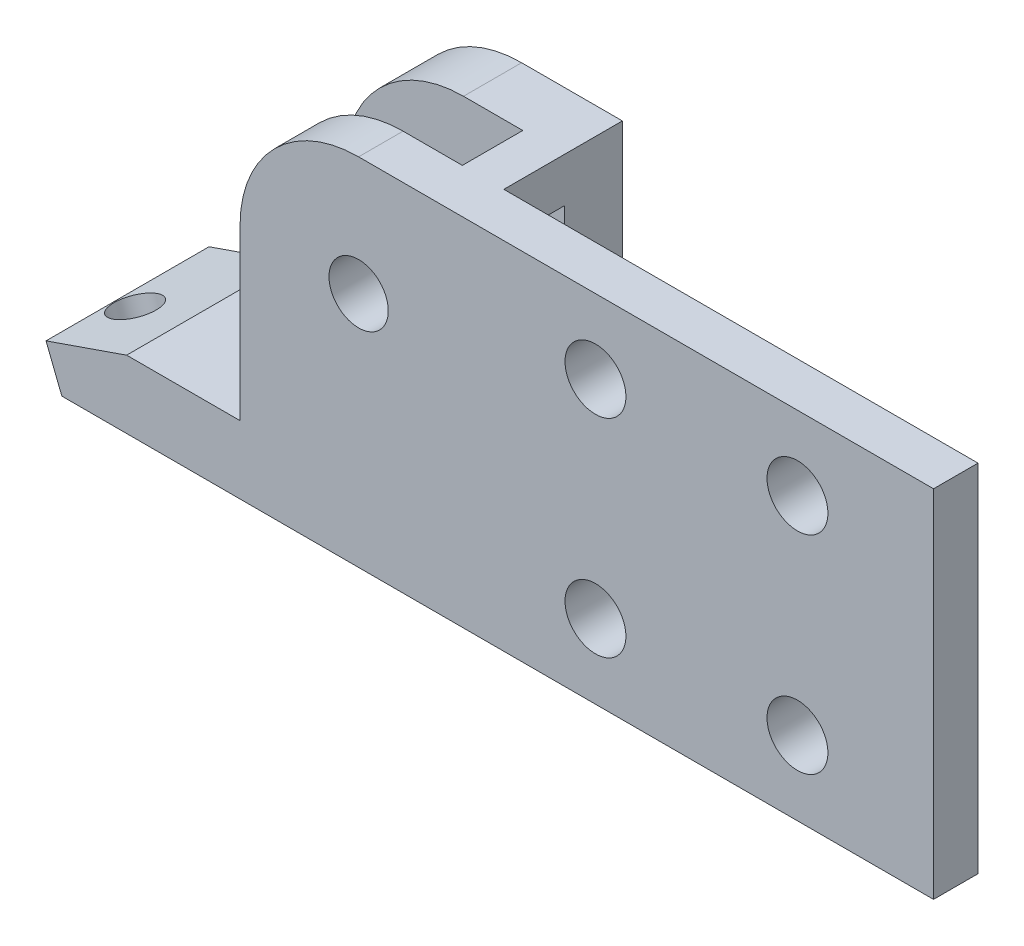
from build123d import *

# Parameters (mm, degrees)
SKETCH2_R                  = 3.175
BOSS_EXTRUDE1_DEPTH        = 4.7625
BOSS_EXTRUDE2_START        = 12.7
BOSS_EXTRUDE2_DEPTH        = 12.7
SKETCH12_W                 = 6.477
SKETCH12_H                 = 21.856650617
CUT_EXTRUDE1_DEPTH         = 24.13
SKETCH12_3_W               = 6.477
SKETCH12_3_H               = 4.7625
CUT_EXTRUDE2_DEPTH         = 19.05
TAP_DRILL_FOR_10_32_TAP1_D = 4.0386
F_1_4_CLEARANCE_HOLE1_D    = 6.5278
SKETCH4_R                  = 2.38125
CUT_EXTRUDE3_DEPTH         = 3.175


with BuildPart() as part:
    # Sketch2 → Boss-Extrude1 (new body)
    with BuildSketch(Plane.XY):
        with BuildLine():
            Line((-67.986186343, -228.533359856), (-69.686856366, -224.252380141))
            Line((-69.686856366, -224.252380141), (-61.0470258, -221.260552334))
            Line((-61.0470258, -221.260552334), (-48.895, -221.260552334))
            Line((-48.895, -221.260552334), (-48.895, -203.133359856))
            ThreePointArc((-48.895, -203.133359856), (-45.175256121, -194.153103735), (-36.195, -190.433359856))
            Line((-36.195, -190.433359856), (25.4, -190.433359856))
            Line((25.4, -190.433359856), (25.4, -228.533359856))
            Line((25.4, -228.533359856), (-67.986186343, -228.533359856))
        make_face()
        with Locations((-36.195, -203.133359856)):
            Circle(SKETCH2_R, mode=Mode.SUBTRACT)
    extrude(amount=BOSS_EXTRUDE1_DEPTH)

    # Sketch11 → Boss-Extrude2 (add)
    with BuildSketch(Plane(origin=(0, 0, 0), x_dir=(-1, 0, 0), z_dir=(0, 0, -1)).offset(BOSS_EXTRUDE2_START)):
        with BuildLine():
            Line((25.4, -190.433359856), (25.4, -228.533359856))
            Line((25.4, -228.533359856), (67.986186343, -228.533359856))
            Line((67.986186343, -228.533359856), (69.686856366, -224.252380141))
            Line((69.686856366, -224.252380141), (61.0470258, -221.260552334))
            Line((61.0470258, -221.260552334), (48.895, -221.260552334))
            Line((48.895, -221.260552334), (48.895, -203.133359856))
            ThreePointArc((48.895, -203.133359856), (45.175256121, -194.153103735), (36.195, -190.433359856))
            Line((36.195, -190.433359856), (25.4, -190.433359856))
        make_face()
    extrude(amount=-BOSS_EXTRUDE2_DEPTH)

    # Sketch12 → Cut-Extrude1 (cut)
    with BuildSketch(Plane.ZY.offset(48.895)):
        with Locations((-3.2385, -206.124185165)):
            Rectangle(SKETCH12_W, SKETCH12_H)
    extrude(amount=-CUT_EXTRUDE1_DEPTH, mode=Mode.SUBTRACT)

    # Sketch12<3> → Cut-Extrude2 (cut)
    with BuildSketch(Plane.ZY.offset(48.895)):
        with Locations((-3.2385, -192.814609856)):
            Rectangle(SKETCH12_3_W, SKETCH12_3_H)
    extrude(amount=-CUT_EXTRUDE2_DEPTH, mode=Mode.SUBTRACT)

    # Tap Drill for #10-32 Tap1 (through all)
    with Locations(Plane.XY.offset(-6.477)):
        with Locations((-36.195, -203.133359856)):
            Hole(TAP_DRILL_FOR_10_32_TAP1_D / 2)

    # 1/4 Clearance Hole1 (through all)
    with Locations(Plane.XY.offset(4.7625)):
        with Locations((-10.8204, -198.370859856), (-10.8204, -220.595859856), (10.8204, -220.595859856), (10.8204, -198.370859856)):
            Hole(F_1_4_CLEARANCE_HOLE1_D / 2)

    # Sketch4 → Cut-Extrude3 (cut)
    with BuildSketch(Plane(origin=(61.878548145, -178.693496479, 0), x_dir=(0.9449482956701711, 0.3272196792829536, 0), z_dir=(-0.3272196792829536, 0.9449482956701711, 0))):
        with Locations((-136.690268062, 2.38125)):
            Circle(SKETCH4_R)
    extrude(amount=-CUT_EXTRUDE3_DEPTH, mode=Mode.SUBTRACT)


solid = part.part
